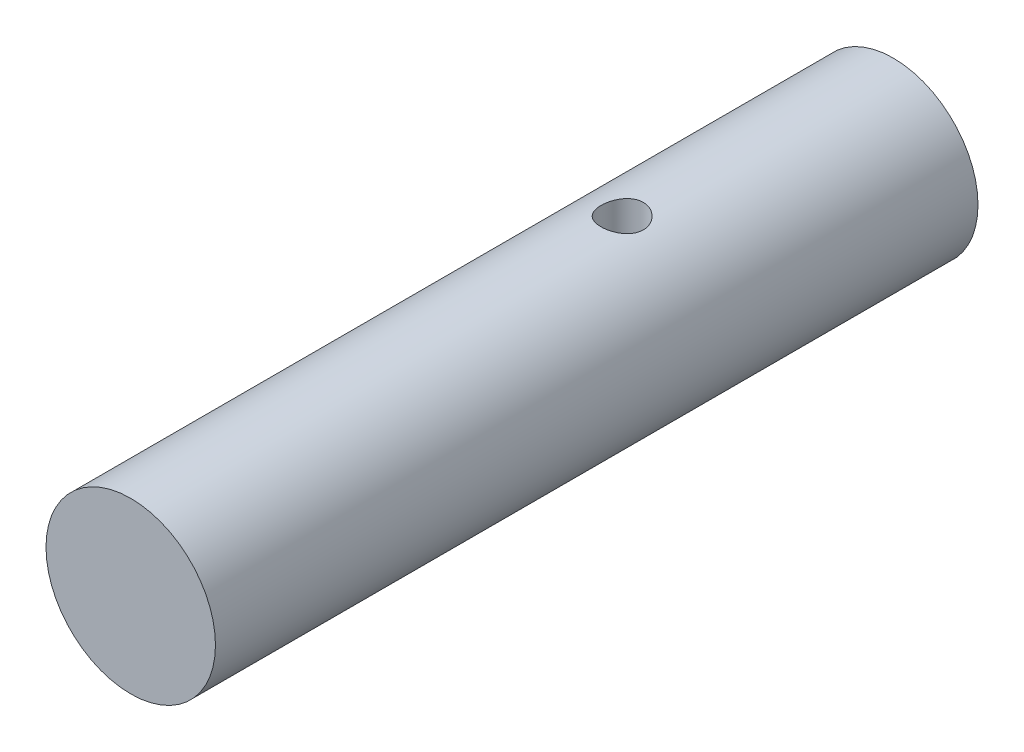
from build123d import *

# Parameters (mm, degrees)
SKETCH_2_R               = 5
EXTRUDE_1_DEPTH          = 45
CUT_EXTRUDE_1_DEPTH      = 46.552167896
CUT_EXTRUDE_1_DEPTH_BACK = 46.552167896
SKETCH_3_R               = 1.25


with BuildPart() as part:
    # ｽｹｯﾁ2 → ﾎﾞｽ - 押し出し1 (new body)
    with BuildSketch(Plane.XY):
        Circle(SKETCH_2_R)
    extrude(amount=EXTRUDE_1_DEPTH)

    # ｽｹｯﾁ3 → ｶｯﾄ - 押し出し1 (cut, two sides: drawn at the far end of the back side and taken through both)
    with BuildSketch(Plane(origin=(0, 0, 0), x_dir=(1, 0, 0), z_dir=(0, 1, 0)).offset(-CUT_EXTRUDE_1_DEPTH_BACK)):
        with Locations((0, -16)):
            Circle(SKETCH_3_R)
    extrude(amount=CUT_EXTRUDE_1_DEPTH + CUT_EXTRUDE_1_DEPTH_BACK, mode=Mode.SUBTRACT)


solid = part.part
